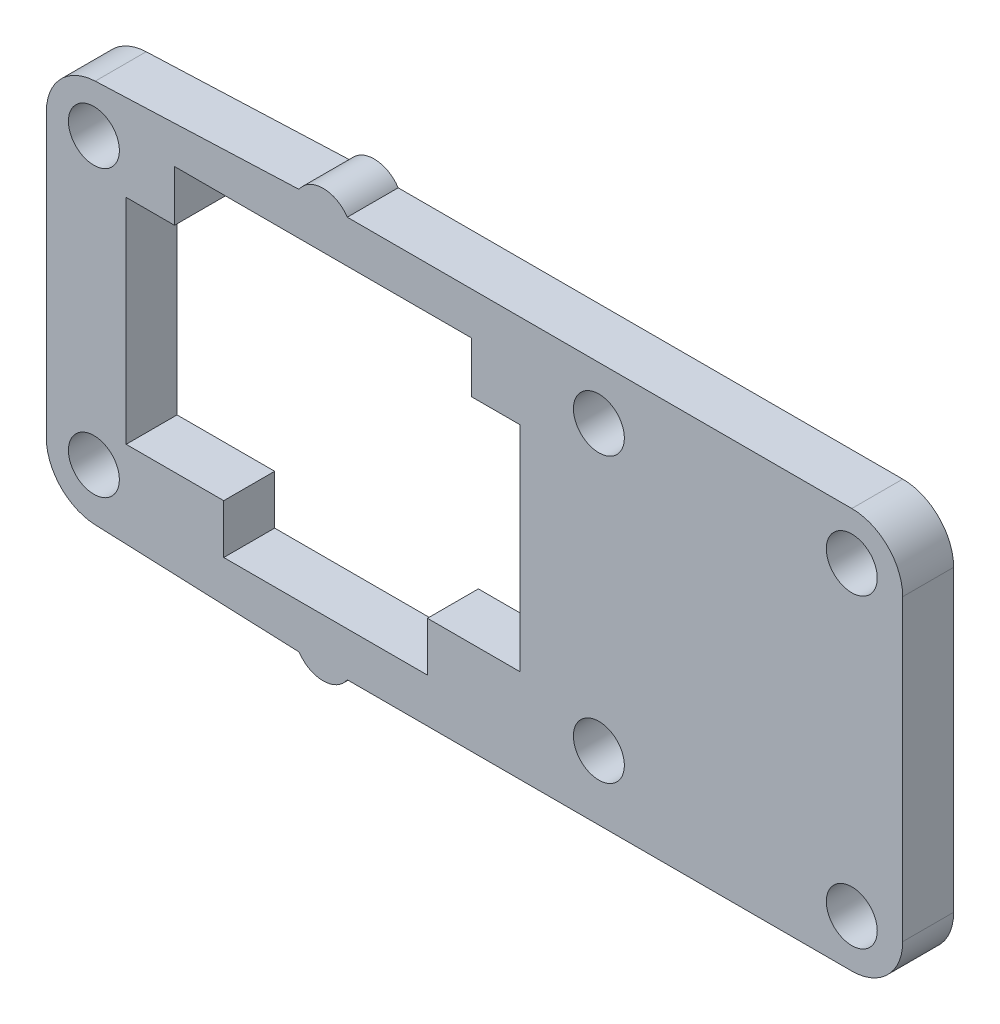
from build123d import *

# Parameters (mm, degrees)
ESQUISSE1_R               = 1.5
T_LE_DE_BASE_PLI_E1_DEPTH = 3
ESQUISSE6_R               = 1.5
ENL_V_MAT_EXTRU_2_DEPTH   = 10


# Sheet-metal steps are written as plain solids
with BuildPart() as part:
    # Esquisse1 → Tôle de base pliée1 (new body)
    with BuildSketch(Plane.XY):
        with BuildLine():
            Line((737.593549902, 733.8762623), (737.593549902, 716.2762623))
            ThreePointArc((737.593549902, 716.2762623), (736.714870246, 714.154941957), (734.593549902, 713.2762623))
            Line((734.593549902, 713.2762623), (704.870597735, 713.2762623))
            ThreePointArc((704.870597735, 713.2762623), (703.450597735, 712.510086472), (702.030597735, 713.2762623))
            Line((702.030597735, 713.2762623), (690.023398786, 713.757541233))
            ThreePointArc((690.023398786, 713.757541233), (687.980166748, 714.67672778), (687.143549902, 716.755134219))
            Line((687.143549902, 716.755134219), (687.143549902, 733.397390382))
            ThreePointArc((687.143549902, 733.397390382), (687.980166748, 735.475796821), (690.023398786, 736.394983368))
            Line((690.023398786, 736.394983368), (702.030597735, 736.8762623))
            ThreePointArc((702.030597735, 736.8762623), (703.450597735, 737.642438129), (704.870597735, 736.8762623))
            Line((704.870597735, 736.8762623), (734.593549902, 736.8762623))
            ThreePointArc((734.593549902, 736.8762623), (736.714870246, 735.997582644), (737.593549902, 733.8762623))
        make_face()
        with Locations((689.943549902, 716.7762623)):
            Circle(ESQUISSE1_R, mode=Mode.SUBTRACT)
        with Locations((734.593549902, 716.0762623)):
            Circle(ESQUISSE1_R, mode=Mode.SUBTRACT)
        with Locations((734.593549902, 734.0762623)):
            Circle(ESQUISSE1_R, mode=Mode.SUBTRACT)
        Polygon((694.693549902, 734.3762623), (712.193549902, 734.3762623), (712.193549902, 731.3762623), (715.043549902, 731.3762623), (715.043549902, 718.7762623), (709.593549902, 718.7762623), (709.593549902, 715.8762623), (697.593549902, 715.8762623), (697.593549902, 718.7762623), (691.843549902, 718.7762623), (691.843549902, 731.3762623), (694.693549902, 731.3762623), align=None, mode=Mode.SUBTRACT)
    extrude(amount=-T_LE_DE_BASE_PLI_E1_DEPTH)

    # Esquisse6 → Enlèv. mat.-Extru.2 (cut)
    with BuildSketch(Plane(origin=(0, 0, -3), x_dir=(-1, 0, 0), z_dir=(0, 0, -1))):
        with Locations((-719.693549902, 733.768635687)):
            Circle(ESQUISSE6_R)
        with Locations((-719.693549902, 717.068635687)):
            Circle(ESQUISSE6_R)
        with Locations((-689.943549902, 733.563854452)):
            Circle(ESQUISSE6_R)
    extrude(amount=-ENL_V_MAT_EXTRU_2_DEPTH, mode=Mode.SUBTRACT)


solid = part.part
